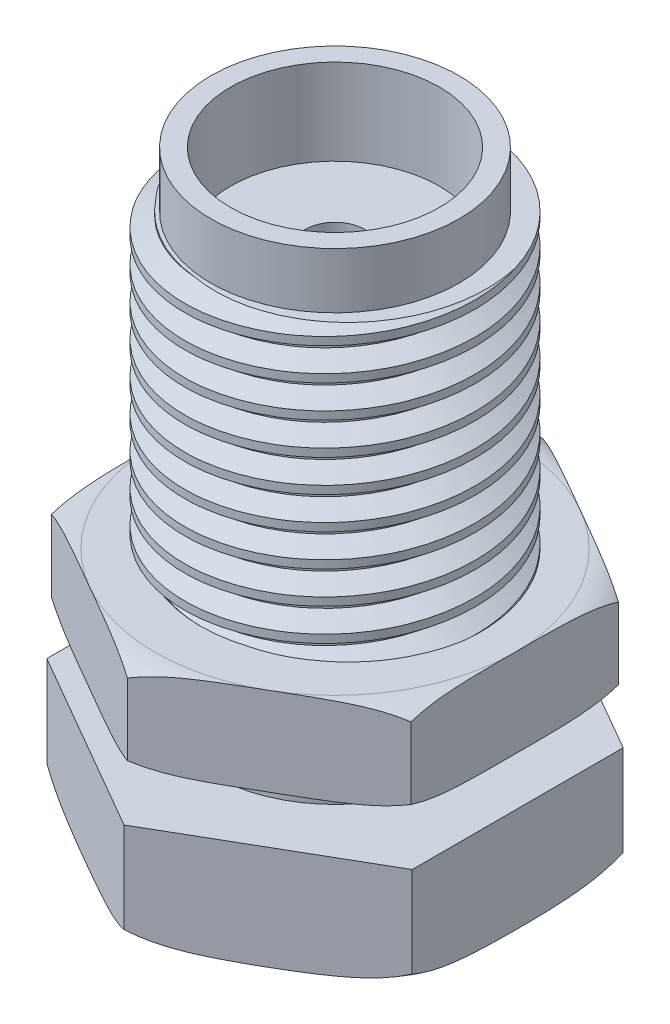
from build123d import *

# Parameters (mm, degrees)
BOSS_EXTRUDE1_DEPTH     = 2.29
SKETCH2_R               = 3.175
BOSS_EXTRUDE2_DEPTH     = 10.54
CUT_SWEEP1_PITCH        = 0.705555556
SKETCH2_2_R             = 3.175
SKETCH2_2_R_2           = 2.716727857
CUT_EXTRUDE_THIN1_DEPTH = 1.2192
CUT_EXTRUDE_THIN3_START = 9.3208
SKETCH2_3_R             = 3.175
SKETCH2_3_R_2           = 2.716727857
CUT_EXTRUDE_THIN3_DEPTH = 1.2192
SKETCH10_R              = 2.7432
BOSS_EXTRUDE3_DEPTH     = 1.93
CHAMFER1_SIZE           = 0.2


with BuildPart() as part:
    # Sketch1 → Boss-Extrude1 (new body)
    with BuildSketch(Plane(origin=(0, 0, 0), x_dir=(1, 0, 0), z_dir=(0, 1, 0))):
        Polygon((0, 4.618802154), (-4, 2.309401077), (-4, -2.309401077), (0, -4.618802154), (4, -2.309401077), (4, 2.309401077), align=None)
    extrude(amount=-BOSS_EXTRUDE1_DEPTH)

    # Sketch2 → Boss-Extrude2 (add)
    with BuildSketch(Plane(origin=(0, 0, 0), x_dir=(1, 0, 0), z_dir=(0, 1, 0))):
        with Locations(Location((0, 0, 0), (0, 0, 270))):
            Circle(SKETCH2_R)
    extrude(amount=BOSS_EXTRUDE2_DEPTH)

    # Cut-Sweep1: the profile of Sketch3 profile screwed along a right-hand helix of 14.4 turns, 6 arcs to a turn; built about Z, then put on its axis
    cut_sweep1_z = Axis((0, 0, 0), (0, 0, 1))
    cut_sweep1_corners = [(2.793106548, 0, 0.044097257), (2.793106548, 0, -0.044097258), (3.1753, 0, -0.26475675), (3.1753, 0, 0.26475675)]
    with BuildLine(mode=Mode.PRIVATE) as cut_sweep1_profile:
        Line(cut_sweep1_corners[0], cut_sweep1_corners[1])
        Line(cut_sweep1_corners[1], cut_sweep1_corners[2])
        Line(cut_sweep1_corners[2], cut_sweep1_corners[3])
        Line(cut_sweep1_corners[3], cut_sweep1_corners[0])
    cut_sweep1_cap = Face(cut_sweep1_profile.wire())
    cut_sweep1_turn_angles = [0, 30, 60, 90, 120, 150, 180, 210, 240, 270, 300, 330, 360]
    cut_sweep1_turn_weights = [1, 0.8660254037844387, 1, 0.8660254037844387, 1, 0.8660254037844387, 1, 0.8660254037844387, 1, 0.8660254037844387, 1, 0.8660254037844387, 1]
    cut_sweep1_turn_rails = [Edge.make_bspline([Vector(p[0], p[1], 0).rotate(cut_sweep1_z, cut_sweep1_turn_angles[k]) / cut_sweep1_turn_weights[k] + Vector(0, 0, p[2] + CUT_SWEEP1_PITCH * cut_sweep1_turn_angles[k] / 360) for k in range(13)], [0, 0, 0, 1, 1, 2, 2, 3, 3, 4, 4, 5, 5, 6, 6, 6], 2, cut_sweep1_turn_weights) for p in cut_sweep1_corners]
    cut_sweep1_turn_sides = [Face.make_surface_from_curves(cut_sweep1_turn_rails[p[0]], cut_sweep1_turn_rails[p[1]]) for p in [(0, 1), (1, 2), (2, 3), (3, 0)]]
    cut_sweep1_last_angles = [5040, 5070, 5100, 5130, 5160, 5172, 5184]
    cut_sweep1_last_weights = [1, 0.8660254037844387, 1, 0.8660254037844387, 1, 0.9781476007337809, 1]
    cut_sweep1_last_rails = [Edge.make_bspline([Vector(p[0], p[1], 0).rotate(cut_sweep1_z, cut_sweep1_last_angles[k]) / cut_sweep1_last_weights[k] + Vector(0, 0, p[2] + CUT_SWEEP1_PITCH * cut_sweep1_last_angles[k] / 360) for k in range(7)], [0, 0, 0, 1, 1, 2, 2, 3, 3, 3], 2, cut_sweep1_last_weights) for p in cut_sweep1_corners]
    cut_sweep1_last_sides = [Face.make_surface_from_curves(cut_sweep1_last_rails[p[0]], cut_sweep1_last_rails[p[1]]) for p in [(0, 1), (1, 2), (2, 3), (3, 0)]]
    cut_sweep1 = Plane(origin=(0, 0.381, 0), x_dir=(1, 0, 0), z_dir=(0, 1, 0)) * Solid(Shell([*[p.moved(Location((0, 0, CUT_SWEEP1_PITCH * i))) for i in range(14) for p in cut_sweep1_turn_sides], *cut_sweep1_last_sides, cut_sweep1_cap, cut_sweep1_cap.rotate(cut_sweep1_z, 5184).moved(Location((0, 0, CUT_SWEEP1_PITCH * 5184 / 360)))]))
    add(cut_sweep1, mode=Mode.SUBTRACT)

    # Sketch2<2> → Cut-Extrude-Thin1 (cut)
    with BuildSketch(Plane(origin=(0, 0, 0), x_dir=(1, 0, 0), z_dir=(0, 1, 0))):
        Circle(SKETCH2_2_R)
        Circle(SKETCH2_2_R_2, mode=Mode.SUBTRACT)
    extrude(amount=CUT_EXTRUDE_THIN1_DEPTH, mode=Mode.SUBTRACT)

    # Sketch2<3> → Cut-Extrude-Thin3 (cut)
    with BuildSketch(Plane(origin=(0, 0, 0), x_dir=(1, 0, 0), z_dir=(0, 1, 0)).offset(CUT_EXTRUDE_THIN3_START)):
        Circle(SKETCH2_3_R)
        Circle(SKETCH2_3_R_2, mode=Mode.SUBTRACT)
    extrude(amount=CUT_EXTRUDE_THIN3_DEPTH, mode=Mode.SUBTRACT)

    # Sketch7 → Cut-Revolve1 (revolve, cut)
    with BuildSketch(Plane.XY, mode=Mode.PRIVATE) as cut_revolve1_sk:
        Polygon((0, 10.54), (2.286, 10.54), (2.286, 8.6604), (0.6477, 8.6604), (0.6477, 5.7394), (0, 5.365450231), align=None)
    revolve(cut_revolve1_sk.sketch.rotate(Axis((0, 5.365450231, 0), (0, 1, 0)), 90), axis=Axis((0, 5.365450231, 0), (0, 1, 0)), mode=Mode.SUBTRACT)

    # Sketch8 → Cut-Revolve2 (revolve, cut)
    with BuildSketch(Plane(origin=(0, 0, 0), x_dir=(0, 0, -1), z_dir=(1, 0, 0))):
        with BuildLine():
            Line((4.618802154, -1.983371364), (4.618802154, -2.29))
            Line((4.618802154, -2.29), (3.820115361, -2.29))
            ThreePointArc((3.820115361, -2.29), (4.247877477, -2.210708959), (4.618802154, -1.983371364))
        make_face()
    revolve(axis=Axis((0, 9.3208, 0), (0, 1, 0)), mode=Mode.SUBTRACT)


with BuildPart() as body_2:
    # Sketch10 → Boss-Extrude3 (new body)
    with BuildSketch(Plane(origin=(0, 1.000000032, 0), x_dir=(1, 0, 0), z_dir=(0, 1, 0))):
        Polygon((0, -4.543746619), (3.935, -2.271873309), (3.935, 2.271873309), (0, 4.543746619), (-3.935, 2.271873309), (-3.935, -2.271873309), align=None)
        with Locations(Location((0, 0, 0), (0, 0, 90))):
            Circle(SKETCH10_R, mode=Mode.SUBTRACT)
    extrude(amount=BOSS_EXTRUDE3_DEPTH)

    # Sketch11 → Cut-Revolve3 (revolve, cut)
    with BuildSketch(Plane(origin=(0, 0, 0), x_dir=(0, 0, -1), z_dir=(1, 0, 0)), mode=Mode.PRIVATE) as cut_revolve3_sk:
        with BuildLine():
            Line((3.935, 2.930000032), (4.543746619, 2.930000032))
            Line((4.543746619, 2.930000032), (4.543746619, 2.749814154))
            ThreePointArc((4.543746619, 2.749814154), (4.252426919, 2.88400789), (3.935, 2.930000032))
        make_face()
        with BuildLine():
            ThreePointArc((3.935, 1.000000032), (4.252426919, 1.045992174), (4.543746619, 1.18018591))
            Line((4.543746619, 1.18018591), (4.543746619, 1.000000032))
            Line((4.543746619, 1.000000032), (3.935, 1.000000032))
        make_face()
    revolve(cut_revolve3_sk.sketch.rotate(Axis((0, 2.930000032, 0), (0, -1, 0)), 180), axis=Axis((0, 2.930000032, 0), (0, -1, 0)), mode=Mode.SUBTRACT)

    # Chamfer1
    chamfer1_edges = [body_2.edges().sort_by_distance(p)[0] for p in [
        (0, 1.000000032, 2.7432),
        (0, 2.930000032, 2.7432),
    ]]
    chamfer(chamfer1_edges, length=CHAMFER1_SIZE)


solid = Compound([part.part, body_2.part])
